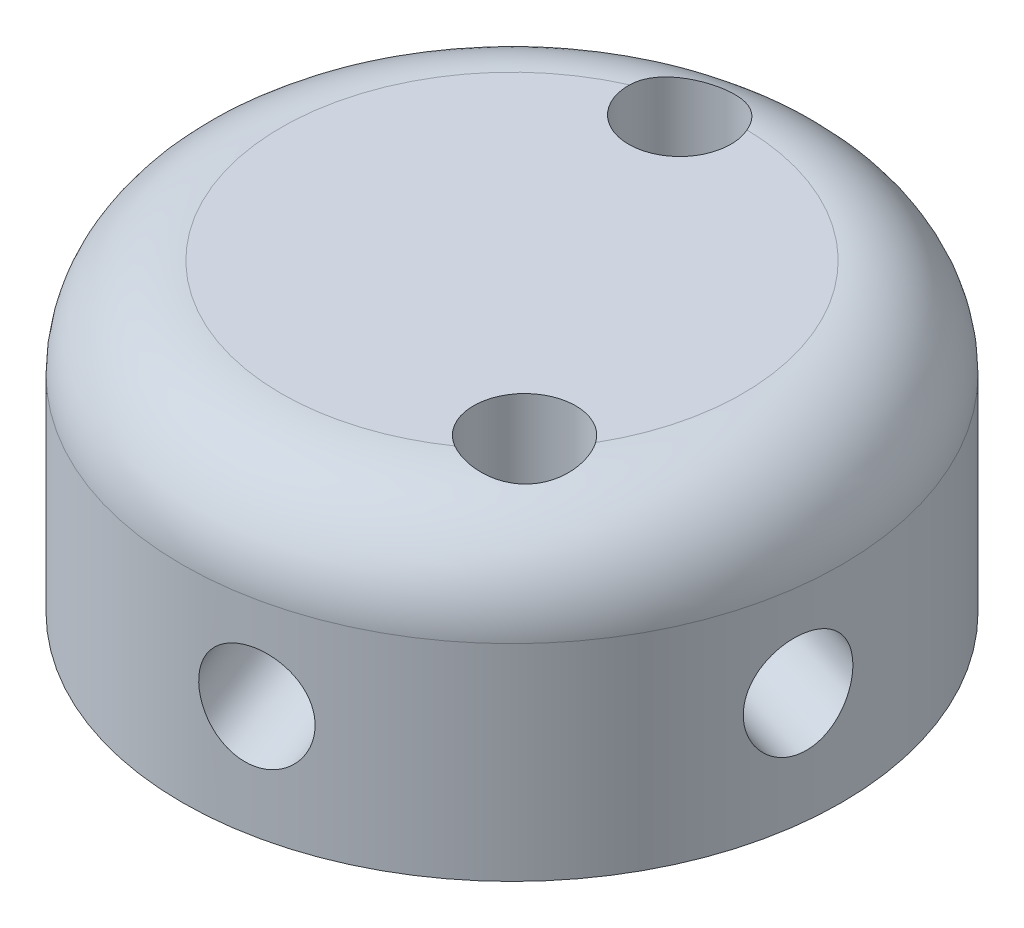
from build123d import *

# Parameters (mm, degrees)
BOSS_EXTRUDE1_DEPTH        = 3
BOSS_EXTRUDE1_DEPTH_BACK   = 10
SKETCH1_R                  = 10
SKETCH4_R                  = 1.5
HOLE_DEPTH                 = 20.973741561
HOLECIR_COUNT              = 5
SKETCH6_R                  = 3.5
BEARINGHOLE_DEPTH          = 2.5
SKETCH7_R                  = 2
SHAFTHOLE_DEPTH            = 17.248076982
F_3_1_3_1_DIAMETER_HOLE1_D = 3.1
FILLET2_R                  = 3
CUT_EXTRUDE1_START         = 10
SKETCH11_R                 = 10
CUT_EXTRUDE1_DEPTH         = 10


with BuildPart() as part:
    # Sketch1 → Boss-Extrude1 (new, two sides: drawn at the far end of the back side and taken through both)
    with BuildSketch(Plane(origin=(0, 0, 0), x_dir=(1, 0, 0), z_dir=(0, 1, 0)).offset(-BOSS_EXTRUDE1_DEPTH_BACK)):
        with Locations(Location((0, 0, 0), (0, 0, 270))):
            Circle(SKETCH1_R)
    extrude(amount=BOSS_EXTRUDE1_DEPTH + BOSS_EXTRUDE1_DEPTH_BACK)

    # Sketch4 → hole (cut, through all)
    with BuildSketch(Plane(origin=(-3.352872105, -1.093066116, 1.887711608), x_dir=(-0.4486862613641547, -0.14627571033740308, -0.8816371449912632), z_dir=(0.8382180262940947, 0.2732665289126682, -0.47192790187872385))):
        with Locations(Location((0, 0, 0), (0, 0, 8.746528197))):
            Circle(SKETCH4_R)
    hole = extrude(amount=-HOLE_DEPTH, mode=Mode.SUBTRACT)

    # holecir: hole ×5 about axis
    holecir_axis = Axis((0, 0, 0), (0, 1, 0))
    for i in range(1, HOLECIR_COUNT):
        add(hole.rotate(holecir_axis, i * 360 / HOLECIR_COUNT), mode=Mode.SUBTRACT)

    # Sketch6 → bearinghole (cut)
    with BuildSketch(Plane(origin=(0, -5, 0), x_dir=(-1, 0, 0), z_dir=(0, -1, 0))):
        with Locations(Location((0, 0, 0), (0, 0, 90))):
            Circle(SKETCH6_R)
    extrude(amount=BEARINGHOLE_DEPTH, mode=Mode.SUBTRACT)

    # Sketch7 → shafthole (cut, through all)
    with BuildSketch(Plane(origin=(0, -5, 0), x_dir=(-1, 0, 0), z_dir=(0, -1, 0))):
        with Locations(Location((0, 0, 0), (0, 0, 90))):
            Circle(SKETCH7_R)
    extrude(amount=SHAFTHOLE_DEPTH, mode=Mode.SUBTRACT)

    # Ø3.1 (3.1) Diameter Hole1 (through all)
    with Locations(Plane(origin=(0, 3, 0), x_dir=(1, 0, 0), z_dir=(0, 1, 0))):
        with Locations((-1.282558474, 6.372208703), (4.783101903, -4.401356176)):
            Hole(F_3_1_3_1_DIAMETER_HOLE1_D / 2)

    # Fillet2
    # the kernel refuses this fillet: 3 mm, written as the material it takes off along each edge
    with BuildSketch(Plane(origin=(0, 3, 0), x_dir=(0, 0, 1), z_dir=(-1, 0, 0))) as fillet2_piece_1:
        with BuildLine():
            CenterArc((10 - FILLET2_R, -FILLET2_R), FILLET2_R, 0, 90)
            Line((10 - FILLET2_R, 0), (10, 0))
            Line((10, 0), (10, -FILLET2_R))
        make_face()
    revolve(axis=Axis((0, 3, 0), (0, 1, 0)), mode=Mode.SUBTRACT)
    with BuildSketch(Plane(origin=(0, -10, 0), x_dir=(0, 0, 1), z_dir=(-1, 0, 0))) as fillet2_piece_2:
        with BuildLine():
            CenterArc((10 - FILLET2_R, FILLET2_R), FILLET2_R, 270, 90)
            Line((10 - FILLET2_R, 0), (10, 0))
            Line((10, 0), (10, FILLET2_R))
        make_face()
    revolve(axis=Axis((0, -10, 0), (0, 1, 0)), mode=Mode.SUBTRACT)

    # Sketch11 → Cut-Extrude1 (cut)
    with BuildSketch(Plane(origin=(0, -6.25, 0), x_dir=(-1, 0, 0), z_dir=(0, -1, 0)).offset(CUT_EXTRUDE1_START)):
        with Locations(Location((0, 0, 0), (0, 0, 270))):
            Circle(SKETCH11_R)
    extrude(amount=-CUT_EXTRUDE1_DEPTH, mode=Mode.SUBTRACT)


solid = part.part
